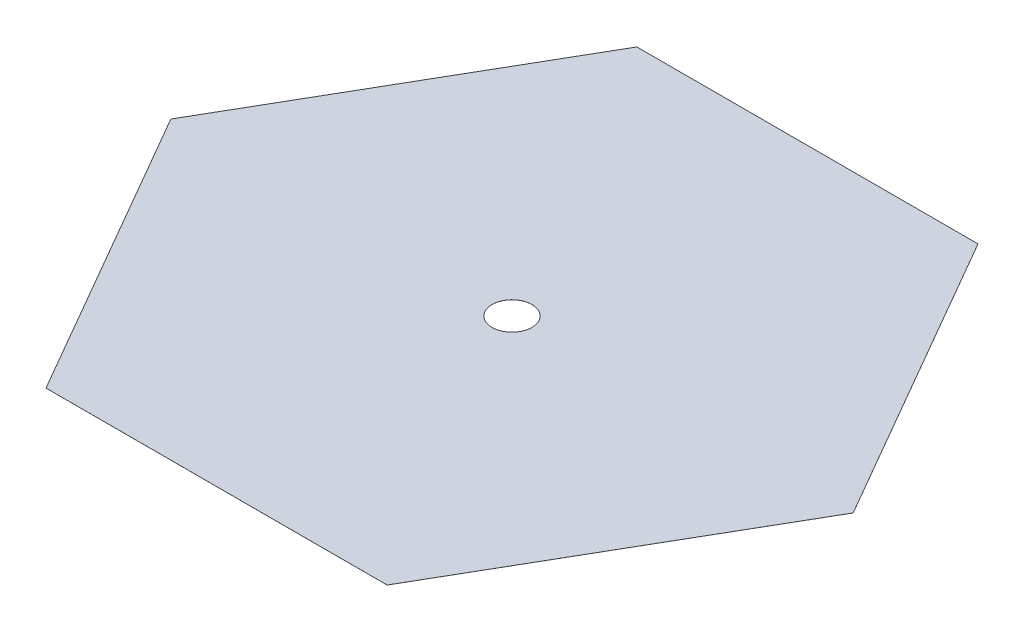
from build123d import *

# Parameters (mm, degrees)
EXTRUDE_1_DEPTH     = 0.06
SKETCH_2_R          = 35
CUT_EXTRUDE_1_DEPTH = 0.06


with BuildPart() as part:
    # Эскиз1 → Бобышка-Вытянуть1 (new body)
    with BuildSketch(Plane(origin=(0, 0, 0), x_dir=(1, 0, 0), z_dir=(0, 1, 0))):
        Polygon((-600, 0), (-300, -519.615242271), (300, -519.615242271), (600, 0), (300, 519.615242271), (-300, 519.615242271), align=None)
    extrude(amount=EXTRUDE_1_DEPTH)

    # Эскиз2 → Вырез-Вытянуть1 (cut)
    with BuildSketch(Plane(origin=(0, 0.06, 0), x_dir=(1, 0, 0), z_dir=(0, 1, 0))):
        Circle(SKETCH_2_R)
    extrude(amount=-CUT_EXTRUDE_1_DEPTH, mode=Mode.SUBTRACT)


solid = part.part
